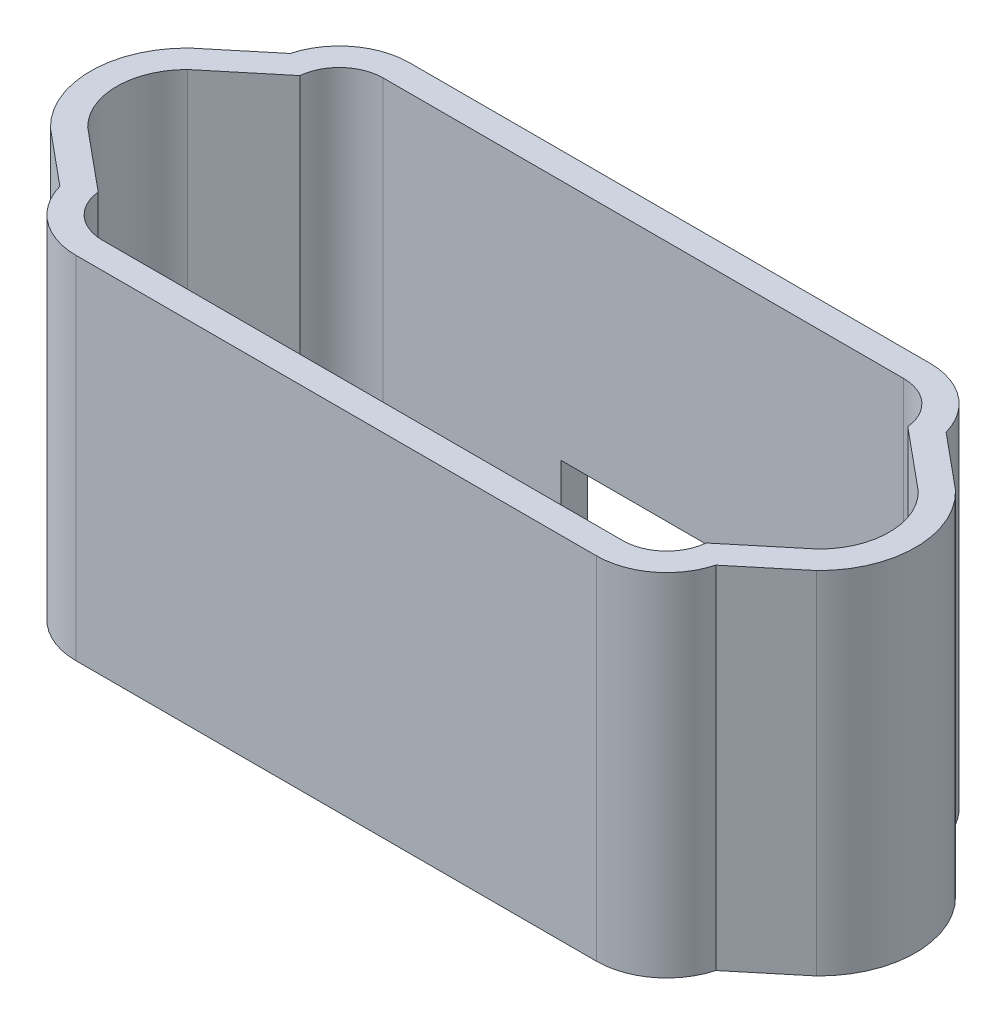
from build123d import *

# Parameters (mm, degrees)
BOSS_EXTRUDE1_DEPTH = 1
BOSS_EXTRUDE2_DEPTH = 20
CUT_EXTRUDE1_DEPTH  = 2
SKETCH3_R           = 1.175
CUT_EXTRUDE2_DEPTH  = 20
MOVE_FACE1_BY       = 0.2
MOVE_FACE1_2_BY     = 0.2
MOVE_FACE1_3_BY     = 0.2
MOVE_FACE1_4_BY     = 0.2
MOVE_FACE1_5_BY     = 0.2
MOVE_START          = 1
MOVE_FACE2_DEPTH    = 19


# Read off the part's stored shape, not the designer's step: Move Face2
with BuildPart() as part:
    # Sketch1 → Boss-Extrude1 (new body)
    with BuildSketch(Plane(origin=(0, 0, 0), x_dir=(1, 0, 0), z_dir=(0, 1, 0))):
        with BuildLine():
            Line((-11.433858941, 48.348949441), (-21.758858941, 48.348949441))
            Line((-21.758858941, 48.348949441), (-30.758858941, 48.348949441))
            Line((-30.758858941, 48.348949441), (-41.083858941, 48.348949441))
            ThreePointArc((-41.083858941, 48.348949441), (-42.498072504, 47.763163004), (-43.083858941, 46.348949441))
            Line((-43.083858941, 46.348949441), (-46.733732675, 43.323823175))
            ThreePointArc((-46.733732675, 43.323823175), (-47.758858941, 40.848949441), (-46.733732675, 38.374075707))
            Line((-46.733732675, 38.374075707), (-43.083858941, 35.348949441))
            ThreePointArc((-43.083858941, 35.348949441), (-42.498072504, 33.934735879), (-41.083858941, 33.348949441))
            Line((-41.083858941, 33.348949441), (-11.433858941, 33.348949441))
            ThreePointArc((-11.433858941, 33.348949441), (-10.019645379, 33.934735879), (-9.433858941, 35.348949441))
            Line((-9.433858941, 35.348949441), (-5.783985207, 38.374075707))
            ThreePointArc((-5.783985207, 38.374075707), (-4.758858941, 40.848949441), (-5.783985207, 43.323823175))
            Line((-5.783985207, 43.323823175), (-9.433858941, 46.348949441))
            ThreePointArc((-9.433858941, 46.348949441), (-10.019645379, 47.763163004), (-11.433858941, 48.348949441))
        make_face()
    extrude(amount=BOSS_EXTRUDE1_DEPTH)

    # Sketch1<3> → Boss-Extrude2 (add)
    with BuildSketch(Plane(origin=(0, 0, 0), x_dir=(1, 0, 0), z_dir=(0, 1, 0))):
        with BuildLine():
            Line((-21.758858941, 50.348949441), (-30.758858941, 50.348949441))
            Line((-30.758858941, 50.348949441), (-41.083858941, 50.348949441))
            ThreePointArc((-41.083858941, 50.348949441), (-43.509516051, 49.529544917), (-44.941375957, 47.407043233))
            Line((-44.941375957, 47.407043233), (-48.073804253, 44.810791471))
            ThreePointArc((-48.073804253, 44.810791471), (-49.758858941, 40.848949441), (-48.073804253, 36.887107411))
            Line((-48.073804253, 36.887107411), (-44.941375957, 34.290855649))
            ThreePointArc((-44.941375957, 34.290855649), (-43.509516051, 32.168353965), (-41.083858941, 31.348949441))
            Line((-41.083858941, 31.348949441), (-11.433858941, 31.348949441))
            ThreePointArc((-11.433858941, 31.348949441), (-9.008201831, 32.168353965), (-7.576341925, 34.290855649))
            Line((-7.576341925, 34.290855649), (-4.443913629, 36.887107411))
            ThreePointArc((-4.443913629, 36.887107411), (-2.758858941, 40.848949441), (-4.443913629, 44.810791471))
            Line((-4.443913629, 44.810791471), (-7.576341925, 47.407043233))
            ThreePointArc((-7.576341925, 47.407043233), (-9.008201831, 49.529544917), (-11.433858941, 50.348949441))
            Line((-11.433858941, 50.348949441), (-21.758858941, 50.348949441))
        make_face()
        with BuildLine():
            Line((-11.433858941, 48.348949441), (-21.758858941, 48.348949441))
            Line((-21.758858941, 48.348949441), (-30.758858941, 48.348949441))
            Line((-30.758858941, 48.348949441), (-41.083858941, 48.348949441))
            ThreePointArc((-41.083858941, 48.348949441), (-42.498072504, 47.763163004), (-43.083858941, 46.348949441))
            Line((-43.083858941, 46.348949441), (-46.733732675, 43.323823175))
            ThreePointArc((-46.733732675, 43.323823175), (-47.758858941, 40.848949441), (-46.733732675, 38.374075707))
            Line((-46.733732675, 38.374075707), (-43.083858941, 35.348949441))
            ThreePointArc((-43.083858941, 35.348949441), (-42.498072504, 33.934735879), (-41.083858941, 33.348949441))
            Line((-41.083858941, 33.348949441), (-11.433858941, 33.348949441))
            ThreePointArc((-11.433858941, 33.348949441), (-10.019645379, 33.934735879), (-9.433858941, 35.348949441))
            Line((-9.433858941, 35.348949441), (-5.783985207, 38.374075707))
            ThreePointArc((-5.783985207, 38.374075707), (-4.758858941, 40.848949441), (-5.783985207, 43.323823175))
            Line((-5.783985207, 43.323823175), (-9.433858941, 46.348949441))
            ThreePointArc((-9.433858941, 46.348949441), (-10.019645379, 47.763163004), (-11.433858941, 48.348949441))
        make_face(mode=Mode.SUBTRACT)
    extrude(amount=BOSS_EXTRUDE2_DEPTH)

    # Sketch2 → Cut-Extrude1 (cut)
    with BuildSketch(Plane.XY.offset(-50.348949441)):
        Polygon((-21.758858941, 1), (-21.758858941, 6), (-30.758858941, 6), (-30.758858941, 1), (-30.758858941, 0), (-21.758858941, 0), align=None)
    extrude(amount=CUT_EXTRUDE1_DEPTH, mode=Mode.SUBTRACT)

    # Sketch3 → Cut-Extrude2 (cut)
    with BuildSketch(Plane(origin=(0, 1, 0), x_dir=(1, 0, 0), z_dir=(0, 1, 0))):
        with Locations(Location((-8.258858941, 40.848949441, 0), (0, 0, 270))):
            Circle(SKETCH3_R)
        with Locations(Location((-44.258858941, 40.848949441, 0), (0, 0, 270))):
            Circle(SKETCH3_R)
    extrude(amount=-CUT_EXTRUDE2_DEPTH, mode=Mode.SUBTRACT)

    # Move Face1: a face moved inward by 0.2
    extrude(part.faces().sort_by_distance((-26.258858941, 6, -49.348949441))[0], amount=MOVE_FACE1_BY, dir=(0, 1, 0), mode=Mode.SUBTRACT)

    # Move Face1 2: a face moved inward by 0.2
    extrude(part.faces().sort_by_distance((-30.758858941, 3, -49.348949441))[0], amount=MOVE_FACE1_2_BY, dir=(-1, 0, 0), mode=Mode.SUBTRACT)

    # Move Face1 3: a face moved inward by 0.2
    extrude(part.faces().sort_by_distance((-21.758858941, 3, -49.348949441))[0], amount=MOVE_FACE1_3_BY, dir=(1, 0, 0), mode=Mode.SUBTRACT)

    # Move Face1 4: a curved face moved inward by 0.2
    add(Solid.thicken(part.faces().sort_by_distance((-44.258858941, 0.5, -42.023949441))[0], -MOVE_FACE1_4_BY), mode=Mode.SUBTRACT)

    # Move Face1 5: a curved face moved inward by 0.2
    add(Solid.thicken(part.faces().sort_by_distance((-8.258858941, 0.5, -42.023949441))[0], -MOVE_FACE1_5_BY), mode=Mode.SUBTRACT)

    # Move Face2 outline → Move Face2 (cut)
    with BuildSketch(Plane(origin=(0, 0, 0), x_dir=(1, 0, 0), z_dir=(0, 1, 0)).offset(MOVE_START)):
        with BuildLine():
            ThreePointArc((-41.083858941, 48.848949441), (-42.762782817, 48.201303246), (-43.571827765, 46.593921137))
            Line((-43.571827765, 46.593921137), (-47.070175615, 43.694384128))
            ThreePointArc((-47.070175615, 43.694384128), (-48.258858941, 40.848949441), (-47.070175615, 38.003514754))
            Line((-47.070175615, 38.003514754), (-43.571827765, 35.103977746))
            ThreePointArc((-43.571827765, 35.103977746), (-42.762782817, 33.496595636), (-41.083858941, 32.848949441))
            Line((-41.083858941, 32.848949441), (-11.433858941, 32.848949441))
            ThreePointArc((-11.433858941, 32.848949441), (-9.754935065, 33.496595636), (-8.945890117, 35.103977746))
            Line((-8.945890117, 35.103977746), (-5.447542267, 38.003514754))
            ThreePointArc((-5.447542267, 38.003514754), (-4.258858941, 40.848949441), (-5.447542267, 43.694384128))
            Line((-5.447542267, 43.694384128), (-8.945890117, 46.593921137))
            ThreePointArc((-8.945890117, 46.593921137), (-9.754935065, 48.201303246), (-11.433858941, 48.848949441))
            Line((-11.433858941, 48.848949441), (-41.083858941, 48.848949441))
        make_face()
        with BuildLine():
            Line((-41.083858941, 48.348949441), (-11.433858941, 48.348949441))
            ThreePointArc((-11.433858941, 48.348949441), (-10.019645379, 47.763163004), (-9.433858941, 46.348949441))
            Line((-9.433858941, 46.348949441), (-5.783985207, 43.323823175))
            ThreePointArc((-5.783985207, 43.323823175), (-4.758858941, 40.848949441), (-5.783985207, 38.374075707))
            Line((-5.783985207, 38.374075707), (-9.433858941, 35.348949441))
            ThreePointArc((-9.433858941, 35.348949441), (-10.019645379, 33.934735879), (-11.433858941, 33.348949441))
            Line((-11.433858941, 33.348949441), (-41.083858941, 33.348949441))
            ThreePointArc((-41.083858941, 33.348949441), (-42.498072504, 33.934735879), (-43.083858941, 35.348949441))
            Line((-43.083858941, 35.348949441), (-46.733732675, 38.374075707))
            ThreePointArc((-46.733732675, 38.374075707), (-47.758858941, 40.848949441), (-46.733732675, 43.323823175))
            Line((-46.733732675, 43.323823175), (-43.083858941, 46.348949441))
            ThreePointArc((-43.083858941, 46.348949441), (-42.498072504, 47.763163004), (-41.083858941, 48.348949441))
        make_face(mode=Mode.SUBTRACT)
    extrude(amount=MOVE_FACE2_DEPTH, mode=Mode.SUBTRACT)


solid = part.part
